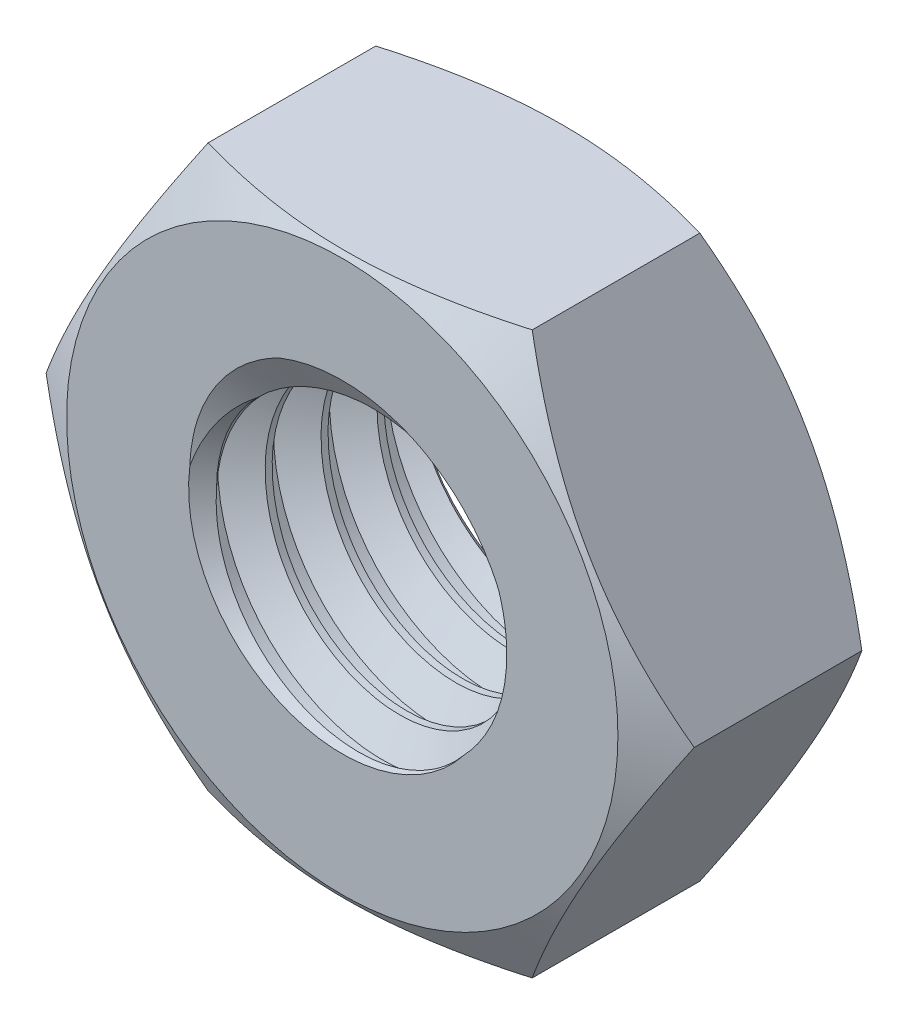
from build123d import *

# Parameters (mm, degrees)
SKETCH2_OUTSIDE_W  = 9.488
SKETCH2_OUTSIDE_H  = 9.488
CUT_EXTRUDE1_DEPTH = 2
THREAD1_PITCH      = 0.5


with BuildPart() as part:
    # Sketch1 → Revolve1 (revolve)
    with BuildSketch(Plane(origin=(0, 0, 0), x_dir=(0, 0, -1), z_dir=(1, 0, 0)), mode=Mode.PRIVATE) as revolve1_sk:
        Polygon((0, 1.375), (0.125, 1.25), (1.875, 1.25), (2, 1.375), (2, 2.466987298), (1.75, 2.9), (0.25, 2.9), (0, 2.466987298), align=None)
    revolve(revolve1_sk.sketch.rotate(Axis((0, 0, 0), (0, 0, -1)), 90), axis=Axis((0, 0, 0), (0, 0, -1)))

    # Sketch2 outside → Cut-Extrude1 (cut)
    with BuildSketch(Plane.XY):
        Rectangle(SKETCH2_OUTSIDE_W, SKETCH2_OUTSIDE_H)
        Polygon((-1.45, 2.511473671), (-2.9, 0), (-1.45, -2.511473671), (1.45, -2.511473671), (2.9, 0), (1.45, 2.511473671), align=None, mode=Mode.SUBTRACT)
    extrude(amount=-CUT_EXTRUDE1_DEPTH, mode=Mode.SUBTRACT)

    # Thread1: the profile of Thread Profile2 profile screwed along a right-hand helix of 7.5 turns, 6 arcs to a turn; built about Z, then put on its axis
    thread1_z = Axis((0, 0, 0), (0, 0, 1))
    thread1_corners = [(1.2497, 0, -0.000173205), (1.2497, 0, 0.437673204), (1.520632938, 0, 0.281249999), (1.520632938, 0, 0.156249999)]
    with BuildLine(mode=Mode.PRIVATE) as thread1_profile:
        Line(thread1_corners[0], thread1_corners[1])
        Line(thread1_corners[1], thread1_corners[2])
        Line(thread1_corners[2], thread1_corners[3])
        Line(thread1_corners[3], thread1_corners[0])
    thread1_cap = Face(thread1_profile.wire())
    thread1_turn_angles = [0, 30, 60, 90, 120, 150, 180, 210, 240, 270, 300, 330, 360]
    thread1_turn_weights = [1, 0.8660254037844387, 1, 0.8660254037844387, 1, 0.8660254037844387, 1, 0.8660254037844387, 1, 0.8660254037844387, 1, 0.8660254037844387, 1]
    thread1_turn_rails = [Edge.make_bspline([Vector(p[0], p[1], 0).rotate(thread1_z, thread1_turn_angles[k]) / thread1_turn_weights[k] + Vector(0, 0, p[2] + THREAD1_PITCH * thread1_turn_angles[k] / 360) for k in range(13)], [0, 0, 0, 1, 1, 2, 2, 3, 3, 4, 4, 5, 5, 6, 6, 6], 2, thread1_turn_weights) for p in thread1_corners]
    thread1_turn_sides = [Face.make_surface_from_curves(thread1_turn_rails[p[0]], thread1_turn_rails[p[1]]) for p in [(0, 1), (1, 2), (2, 3), (3, 0)]]
    thread1_last_angles = [2520, 2550, 2580, 2610, 2640, 2670, 2700]
    thread1_last_weights = [1, 0.8660254037844387, 1, 0.8660254037844387, 1, 0.8660254037844327, 1]
    thread1_last_rails = [Edge.make_bspline([Vector(p[0], p[1], 0).rotate(thread1_z, thread1_last_angles[k]) / thread1_last_weights[k] + Vector(0, 0, p[2] + THREAD1_PITCH * thread1_last_angles[k] / 360) for k in range(7)], [0, 0, 0, 1, 1, 2, 2, 3, 3, 3], 2, thread1_last_weights) for p in thread1_corners]
    thread1_last_sides = [Face.make_surface_from_curves(thread1_last_rails[p[0]], thread1_last_rails[p[1]]) for p in [(0, 1), (1, 2), (2, 3), (3, 0)]]
    thread1 = Plane(origin=(0, 0, 0.875), x_dir=(-1, 0, 0), z_dir=(0, 0, -1)) * Solid(Shell([*[p.moved(Location((0, 0, THREAD1_PITCH * i))) for i in range(7) for p in thread1_turn_sides], *thread1_last_sides, thread1_cap, thread1_cap.rotate(thread1_z, 2700).moved(Location((0, 0, THREAD1_PITCH * 2700 / 360)))]))
    add(thread1, mode=Mode.SUBTRACT)


solid = part.part
